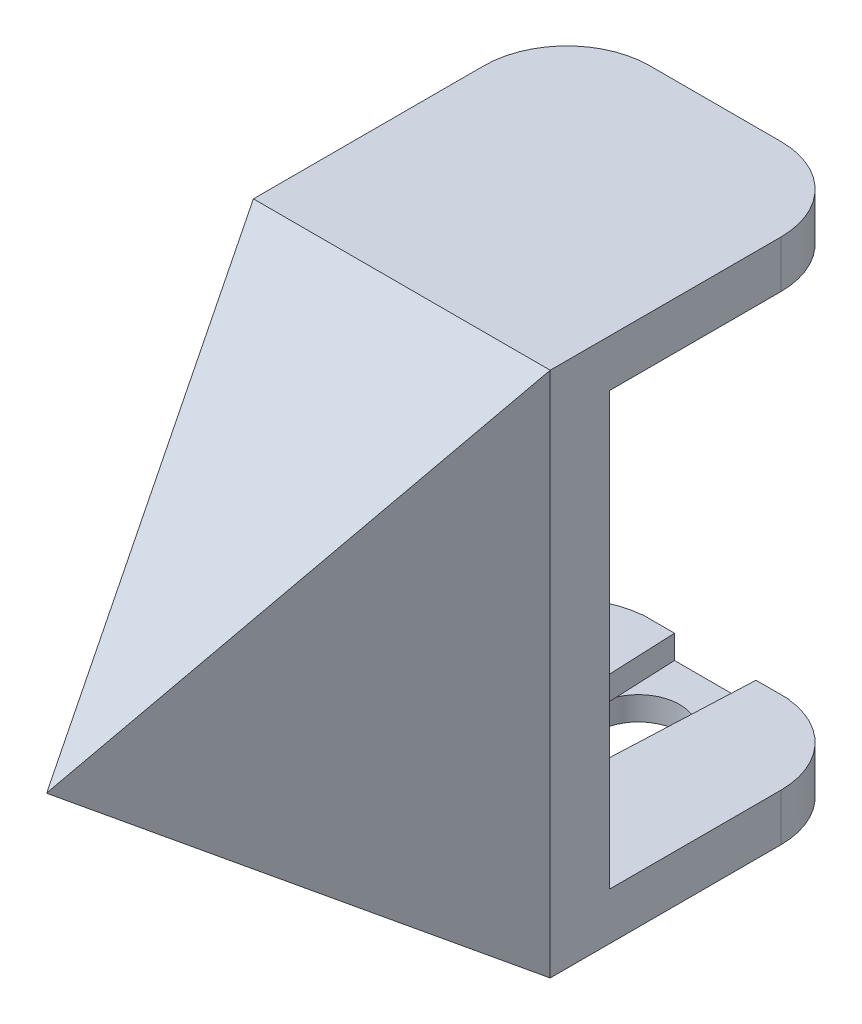
from build123d import *
from OCP.BRepFilletAPI import BRepFilletAPI_MakeChamfer

# Parameters (mm, degrees)
SKETCH4_W                = 12.46
SKETCH4_H                = 17.25
BOSS_EXTRUDE3_DEPTH      = 6
BOSS_EXTRUDE6_DEPTH      = 7.3
BOSS_EXTRUDE6_DEPTH_BACK = 17.25
SKETCH8_R                = 12.546781182
SKETCH8_R_2              = 11.15
BOSS_EXTRUDE4_DEPTH      = 17.25
SKETCH6_R                = 2
CUT_EXTRUDE1_DEPTH       = 5
CHAMFER1_SIZE            = 0.5
CHAMFER1_SIZE_2          = 0.866025404
SKETCH10_W               = 12.46
SKETCH10_H               = 23.7
CUT_EXTRUDE3_DEPTH       = 17.25
CUT_EXTRUDE4_REACH       = 43.938
SKETCH11_W               = 5
SKETCH11_H               = 3
BOSS_EXTRUDE7_START      = -7.3
BOSS_EXTRUDE7_DEPTH      = 7.3
BOSS_EXTRUDE9_START      = 10
BOSS_EXTRUDE9_DEPTH      = 10
BOSS_EXTRUDE10_DEPTH     = 25.093562364
SKETCH18_W               = 21.5
SKETCH18_H               = 12.438292938
CUT_EXTRUDE5_DEPTH       = 2
CUT_EXTRUDE6_DEPTH       = 58.154608998
CUT_EXTRUDE6_DEPTH_BACK  = 58.154608998
SKETCH19_R               = 3.5
FILLET1_R                = 7
CUT_EXTRUDE7_DEPTH       = 55.97840444
CUT_EXTRUDE7_DEPTH_BACK  = 55.97840444
SKETCH20_W               = 25.093562364
SKETCH20_H               = 36.096781182
BOSS_EXTRUDE11_DEPTH     = 44.5
CUT_EXTRUDE8_DEPTH       = 40.401576339
CUT_EXTRUDE8_DEPTH_BACK  = 40.401576339
CUT_EXTRUDE9_DEPTH       = 40.401576339
CUT_EXTRUDE9_DEPTH_BACK  = 40.401576339
SKETCH24_R               = 6.5
BOSS_EXTRUDE12_DEPTH     = 5
SKETCH25_R               = 6.075
BOSS_EXTRUDE13_DEPTH     = 5
FILLET2_R                = 1
BOSS_EXTRUDE14_DEPTH     = 2
CUT_EXTRUDE10_REACH      = 57.104
SKETCH27_R               = 0.75


with BuildPart() as part:
    # Sketch4 → Boss-Extrude3 (new body)
    with BuildSketch(Plane.XY):
        with Locations((0, -1.35)):
            Rectangle(SKETCH4_W, SKETCH4_H)
    extrude(amount=BOSS_EXTRUDE3_DEPTH)



with BuildPart() as body_2:
    # Sketch8 → Boss-Extrude6 (new, two sides: drawn at the far end of the back side and taken through both)
    with BuildSketch(Plane(origin=(0, -9.975, 0), x_dir=(-1, 0, 0), z_dir=(0, -1, 0)).offset(-BOSS_EXTRUDE6_DEPTH_BACK)):
        with Locations(Location((0, -23.55, 0), (0, 0, 90))):
            Circle(SKETCH8_R)
        with Locations(Location((0, -23.55, 0), (0, 0, 90))):
            Circle(SKETCH8_R_2, mode=Mode.SUBTRACT)
    extrude(amount=BOSS_EXTRUDE6_DEPTH + BOSS_EXTRUDE6_DEPTH_BACK)


with BuildPart() as part_1:
    add(part.part)

    add(body_2.part)  # Boss-Extrude4 merges body 2
    # Sketch5 → Boss-Extrude4 (add)
    with BuildSketch(Plane(origin=(0, 7.275, 0), x_dir=(1, 0, 0), z_dir=(0, 1, 0))):
        with BuildLine():
            Line((12.546781182, -23.55), (12.546781182, 0))
            Line((12.546781182, 0), (6.23, 0))
            Line((6.23, 0), (6.23, -29.7))
            Line((6.23, -29.7), (-6.23, -29.7))
            Line((-6.23, -29.7), (-6.23, 0))
            Line((-6.23, 0), (-12.546781182, 0))
            Line((-12.546781182, 0), (-12.546781182, -23.55))
            ThreePointArc((-12.546781182, -23.55), (0, -36.096781182), (12.546781182, -23.55))
        make_face()
    extrude(amount=-BOSS_EXTRUDE4_DEPTH)

    # Sketch6 → Cut-Extrude1 (cut)
    with BuildSketch(Plane(origin=(0, 7.275, 0), x_dir=(1, 0, 0), z_dir=(0, 1, 0))):
        with Locations(Location((0, -3.5, 0), (0, 0, 270))):
            Circle(SKETCH6_R)
        with Locations(Location((0, -32.2, 0), (0, 0, 270))):
            Circle(SKETCH6_R)
    extrude(amount=-CUT_EXTRUDE1_DEPTH, mode=Mode.SUBTRACT)

    # Chamfer1
    chamfer1_edges_1 = [part_1.edges().sort_by_distance(p)[0] for p in [
        (0, 7.275, 1.5),
    ]]
    chamfer1_side_1 = [part_1.faces().sort_by_distance(p)[0] for p in [
        (0, 7.275, 1.49),
    ]]
    chamfer1_edges_2 = [part_1.edges().sort_by_distance(p)[0] for p in [
        (0, 7.275, 30.2),
    ]]
    chamfer1_side_2 = [part_1.faces().sort_by_distance(p)[0] for p in [
        (0, 7.275, 30.19),
    ]]
    chamfer1 = BRepFilletAPI_MakeChamfer(part_1.part.solid().wrapped)
    for e in chamfer1_edges_1:
        chamfer1.Add(CHAMFER1_SIZE - 0.0001, CHAMFER1_SIZE_2 - 0.0001, e.wrapped, chamfer1_side_1[0].wrapped)
    for e in chamfer1_edges_2:
        chamfer1.Add(CHAMFER1_SIZE - 0.0001, CHAMFER1_SIZE_2 - 0.0001, e.wrapped, chamfer1_side_2[0].wrapped)
    add(Compound.cast(chamfer1.Shape()), mode=Mode.REPLACE)  # a hair under: the kernel refuses the full size

    # Sketch10 → Cut-Extrude3 (cut)
    with BuildSketch(Plane(origin=(0, 7.275, 0), x_dir=(1, 0, 0), z_dir=(0, 1, 0))):
        with Locations((0, -17.85)):
            Rectangle(SKETCH10_W, SKETCH10_H)
    extrude(amount=-CUT_EXTRUDE3_DEPTH, mode=Mode.SUBTRACT)

    # Sketch11 → Cut-Extrude4 (cut, up to next)
    with BuildSketch(Plane.XY.offset(36.096781182), mode=Mode.PRIVATE) as cut_extrude4_sk1:
        with Locations((0, -8.475)):
            Rectangle(SKETCH11_W, SKETCH11_H)
    cut_extrude4_tool1 = extrude(cut_extrude4_sk1.sketch, amount=-CUT_EXTRUDE4_REACH, mode=Mode.PRIVATE) & part_1.part
    add(cut_extrude4_tool1.solids().sort_by_distance((0, -8.475, 36.096781))[0], mode=Mode.SUBTRACT)

    # Sketch13 → Boss-Extrude7 (add)
    with BuildSketch(Plane.XZ.offset(17.275).offset(BOSS_EXTRUDE7_START)):
        with BuildLine():
            Line((-12.546781182, 23.55), (-12.546781182, 0))
            Line((-12.546781182, 0), (12.546781182, 0))
            Line((12.546781182, 0), (12.546781182, 23.55))
            ThreePointArc((12.546781182, 23.55), (0, 11.003218818), (-12.546781182, 23.55))
        make_face()
    extrude(amount=BOSS_EXTRUDE7_DEPTH)

    # Sketch15 → Boss-Extrude9 (add)
    with BuildSketch(Plane(origin=(0, 7.275, 0), x_dir=(1, 0, 0), z_dir=(0, 1, 0)).offset(BOSS_EXTRUDE9_START)):
        with BuildLine():
            Line((-12.546781182, 0), (12.546781182, 0))
            Line((12.546781182, 0), (12.546781182, -23.55))
            ThreePointArc((12.546781182, -23.55), (0, -36.096781182), (-12.546781182, -23.55))
            Line((-12.546781182, -23.55), (-12.546781182, 0))
        make_face()
        with BuildLine():
            Line((-6.23, -0.8), (6.23, -0.8))
            Line((6.23, -0.8), (6.23, -33.5))
            ThreePointArc((6.23, -33.5), (5.937106781, -34.207106781), (5.23, -34.5))
            Line((5.23, -34.5), (-5.23, -34.5))
            ThreePointArc((-5.23, -34.5), (-5.937106781, -34.207106781), (-6.23, -33.5))
            Line((-6.23, -33.5), (-6.23, -0.8))
        make_face(mode=Mode.SUBTRACT)
    extrude(amount=-BOSS_EXTRUDE9_DEPTH)

    # Sketch17 → Boss-Extrude10 (add)
    with BuildSketch(Plane(origin=(-12.546781182, 4.728218818, 0), x_dir=(0, -1, 0), z_dir=(1, 0, 0))):
        Polygon((26.978218818, 26.5), (26.978218818, 0), (-17.521781182, 0), (-17.521781182, 26.5), (-13.521781182, 26.5), (-13.521781182, 5), (22.978218818, 5), (22.978218818, 26.5), align=None)
    extrude(amount=BOSS_EXTRUDE10_DEPTH)

    # Sketch18 → Cut-Extrude5 (cut)
    with BuildSketch(Plane.ZX.offset(-18.25)):
        with Locations((-15.75, 0)):
            Rectangle(SKETCH18_W, SKETCH18_H)
    extrude(amount=-CUT_EXTRUDE5_DEPTH, mode=Mode.SUBTRACT)

    # Sketch19 → Cut-Extrude6 (cut, two sides: drawn at the far end of the back side and taken through both)
    with BuildSketch(Plane.ZX.offset(-20.25).offset(-CUT_EXTRUDE6_DEPTH_BACK)):
        with Locations((-20, 0)):
            Circle(SKETCH19_R)
    extrude(amount=CUT_EXTRUDE6_DEPTH + CUT_EXTRUDE6_DEPTH_BACK, mode=Mode.SUBTRACT)

    # Fillet1
    fillet1_edges = [part_1.edges().sort_by_distance(p)[0] for p in [
        (12.546781182, -20.25, -26.5),
        (-12.546781182, -20.25, -26.5),
        (-12.546781182, 20.25, -26.5),
        (12.546781182, 20.25, -26.5),
    ]]
    fillet(fillet1_edges, radius=FILLET1_R)

    # Sketch20 → Cut-Extrude7 (cut, two sides: drawn at the far end of the back side and taken through both)
    with BuildSketch(Plane(origin=(0, 17.275, 0), x_dir=(1, 0, 0), z_dir=(0, 1, 0)).offset(-CUT_EXTRUDE7_DEPTH_BACK)):
        with Locations((0, -18.048390591)):
            Rectangle(SKETCH20_W, SKETCH20_H)
    extrude(amount=CUT_EXTRUDE7_DEPTH + CUT_EXTRUDE7_DEPTH_BACK, mode=Mode.SUBTRACT)

    # Sketch21 → Boss-Extrude11 (add)
    with BuildSketch(Plane(origin=(0, 22.25, 0), x_dir=(1, 0, 0), z_dir=(0, 1, 0))):
        Polygon((12.546781182, 0), (-0.025415104, -30), (-12.546781182, 0), align=None)
    extrude(amount=-BOSS_EXTRUDE11_DEPTH)

    # Sketch22 → Cut-Extrude8 (cut, two sides: drawn at the far end of the back side and taken through both)
    with BuildSketch(Plane(origin=(0, 0, 0), x_dir=(0, 0, -1), z_dir=(1, 0, 0)).offset(-CUT_EXTRUDE8_DEPTH_BACK)):
        Polygon((0, 22.25), (-30, 0.01), (-30, 22.25), align=None)
        Polygon((0, -22.25), (-30, -22.25), (-30, -0.01), align=None)
    extrude(amount=CUT_EXTRUDE8_DEPTH + CUT_EXTRUDE8_DEPTH_BACK, mode=Mode.SUBTRACT)

    # Sketch23 → Cut-Extrude9 (cut, two sides: drawn at the far end of the back side and taken through both)
    with BuildSketch(Plane(origin=(0, 0, 0), x_dir=(-1, 0, 0), z_dir=(0, 0, -1)).offset(-CUT_EXTRUDE9_DEPTH_BACK)):
        Polygon((12.546781182, 18.25), (0, 0), (12.546781182, -22.25), align=None)
    extrude(amount=CUT_EXTRUDE9_DEPTH + CUT_EXTRUDE9_DEPTH_BACK, mode=Mode.SUBTRACT)

    # Sketch24 → Boss-Extrude12 (add)
    with BuildSketch(Plane(origin=(0, 22.25, 0), x_dir=(1, 0, 0), z_dir=(0, 1, 0))):
        with Locations(Location((0, 20, 0), (0, 0, 270))):
            Circle(SKETCH24_R)
    extrude(amount=-BOSS_EXTRUDE12_DEPTH)

    # Sketch25 → Boss-Extrude13 (add)
    with BuildSketch(Plane.XZ.offset(-17.25)):
        with Locations(Location((0, -20, 0), (0, 0, 270))):
            Circle(SKETCH25_R)
    extrude(amount=BOSS_EXTRUDE13_DEPTH)

    # Fillet2
    fillet2_edges = [part_1.edges().sort_by_distance(p)[0] for p in [
        (0, 12.25, -13.925),
    ]]
    fillet(fillet2_edges, radius=FILLET2_R)

    # Sketch26 → Boss-Extrude14 (add)
    with BuildSketch(Plane(origin=(0, -20.25, 0), x_dir=(1, 0, 0), z_dir=(0, 1, 0))):
        Polygon((-6.219146469, 5), (-2.5, 5), (-3.1585, 20), (-3.44385, 26.5), (-6.219146469, 26.5), align=None)
        Polygon((3.1585, 20), (3.44385, 26.5), (6.219146469, 26.5), (6.219146469, 5), (2.5, 5), align=None)
    extrude(amount=BOSS_EXTRUDE14_DEPTH)

    # Sketch27 → Cut-Extrude10 (cut, up to next)
    with BuildSketch(Plane.XZ.offset(22.25), mode=Mode.PRIVATE) as cut_extrude10_sk1:
        with Locations(Location((0, -10, 0), (0, 0, 270))):
            Circle(SKETCH27_R)
    cut_extrude10_tool1 = extrude(cut_extrude10_sk1.sketch, amount=-CUT_EXTRUDE10_REACH, mode=Mode.PRIVATE) & part_1.part
    add(cut_extrude10_tool1.solids().sort_by_distance((0, -22.25, -10))[0], mode=Mode.SUBTRACT)


solid = part_1.part
